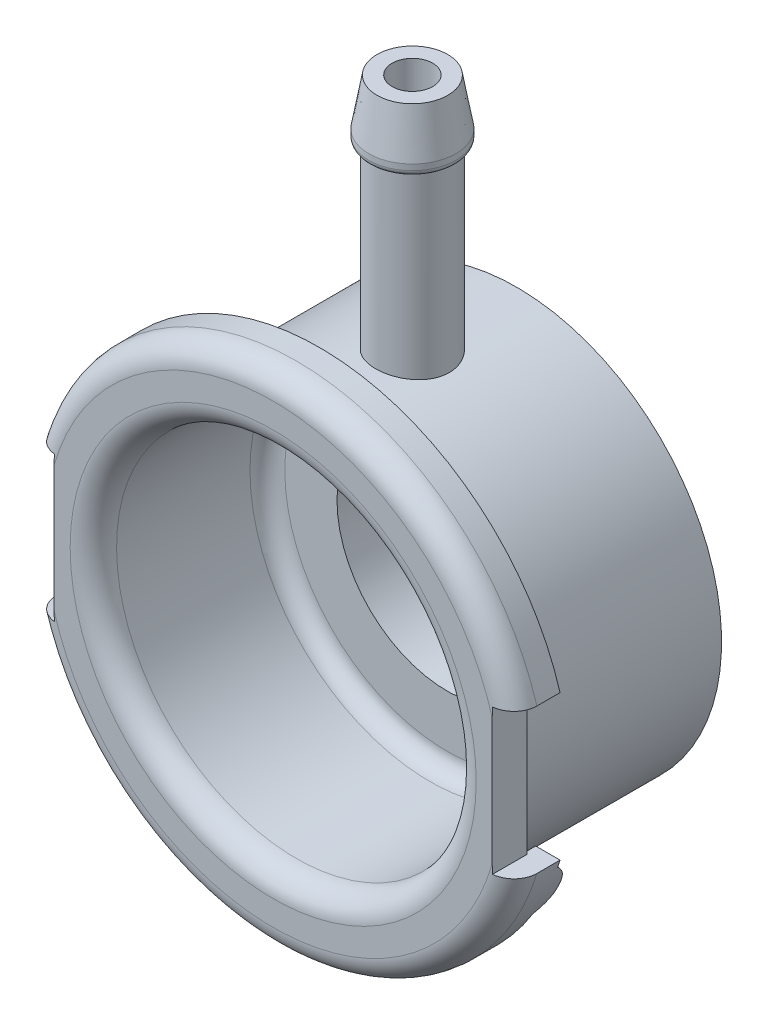
from build123d import *

# Parameters (mm, degrees)
SKETCH1_R                = 17.65
SKETCH1_R_2              = 15.5
BOSS_EXTRUDE1_DEPTH      = 18
BOSS_EXTRUDE2_START      = -3
SKETCH2_R                = 21.65
SKETCH2_R_2              = 15.5
BOSS_EXTRUDE2_DEPTH      = 3
SKETCH3_W                = 5
SKETCH3_H                = 12.5
CUT_EXTRUDE1_DEPTH       = 36.516826998
BOSS_EXTRUDE3_START      = 1
BOSS_EXTRUDE3_DEPTH      = 1
BOSS_EXTRUDE4_START      = 1
BOSS_EXTRUDE4_DEPTH      = 1
CIRPATTERN1_COUNT        = 2
FILLET1_R                = 3
FILLET2_R                = 2
SKETCH6_R                = 1.75
CUT_EXTRUDE2_DEPTH       = 35.96258732
BOSS_EXTRUDE5_REACH      = 74.963
BOSS_EXTRUDE5_END_RADIUS = 17.65
BOSS_EXTRUDE5_START      = 38
SKETCH6_4_R              = 3.175
SKETCH6_4_R_2            = 1.75
SKETCH7_R                = 3.755
SKETCH7_R_2              = 1.75
BOSS_EXTRUDE6_DEPTH      = 5
CHAMFER1_SIZE            = 4
CHAMFER1_SIZE2           = 0.705307923
BOSS_EXTRUDE7_DEPTH      = 3
BOSS_EXTRUDE7_DEPTH_BACK = 3
SKETCH8_R                = 17.65
SKETCH8_R_2              = 9.5
FILLET4_R                = 1.5
FILLET5_R                = 0.5


with BuildPart() as part:
    # Sketch1 → Boss-Extrude1 (new body)
    with BuildSketch(Plane.XY):
        Circle(SKETCH1_R)
        Circle(SKETCH1_R_2, mode=Mode.SUBTRACT)
    extrude(amount=BOSS_EXTRUDE1_DEPTH)

    # Sketch2 → Boss-Extrude2 (add)
    with BuildSketch(Plane.XY.offset(18).offset(BOSS_EXTRUDE2_START)):
        Circle(SKETCH2_R)
        Circle(SKETCH2_R_2, mode=Mode.SUBTRACT)
    extrude(amount=BOSS_EXTRUDE2_DEPTH)

    # Sketch3 → Cut-Extrude1 (cut, through all)
    with BuildSketch(Plane.XY.offset(18)):
        with Locations((21.38, 0)):
            Rectangle(SKETCH3_W, SKETCH3_H)
        with Locations((-21.38, 0)):
            Rectangle(SKETCH3_W, SKETCH3_H)
    extrude(amount=-CUT_EXTRUDE1_DEPTH, mode=Mode.SUBTRACT)

    # Sketch4 → Boss-Extrude3 (add)
    with BuildSketch(Plane(origin=(0, 0, 15), x_dir=(-1, 0, 0), z_dir=(0, 0, -1)).offset(BOSS_EXTRUDE3_START)):
        with BuildLine():
            Line((-20.728241604, -6.25), (-18.629546425, -6.25))
            ThreePointArc((-18.629546425, -6.25), (0, -19.65), (18.629546425, -6.25))
            Line((18.629546425, -6.25), (20.728241604, -6.25))
            ThreePointArc((20.728241604, -6.25), (0, -21.65), (-20.728241604, -6.25))
        make_face()
        with BuildLine():
            Line((-20.728241604, 6.25), (-18.629546425, 6.25))
            ThreePointArc((-18.629546425, 6.25), (0, 19.65), (18.629546425, 6.25))
            Line((18.629546425, 6.25), (20.728241604, 6.25))
            ThreePointArc((20.728241604, 6.25), (0, 21.65), (-20.728241604, 6.25))
        make_face()
    extrude(amount=-BOSS_EXTRUDE3_DEPTH)

    # Sketch5 → Boss-Extrude4 (add)
    with BuildSketch(Plane(origin=(0, 0, 14), x_dir=(-1, 0, 0), z_dir=(0, 0, -1)).offset(BOSS_EXTRUDE4_START)):
        with BuildLine():
            Line((-18.629546425, -6.25), (-20.525683466, -6.886132316))
            ThreePointArc((-20.525683466, -6.886132316), (-19.593212906, -9.210239302), (-18.398607414, -11.411123749))
            Line((-18.398607414, -11.411123749), (-16.698967007, -10.356978368))
            ThreePointArc((-16.698967007, -10.356978368), (-17.783216333, -8.359408882), (-18.629546425, -6.25))
        make_face()
    boss_extrude4 = extrude(amount=-BOSS_EXTRUDE4_DEPTH)

    # CirPattern1: Boss-Extrude4 ×2 about axis
    cirpattern1_axis = Axis((0, 0, 0), (0, 0, 1))
    for i in range(1, CIRPATTERN1_COUNT):
        add(boss_extrude4.rotate(cirpattern1_axis, i * 360 / CIRPATTERN1_COUNT))

    # Fillet1
    # the kernel refuses this fillet: 3 mm, written as the material it takes off along each edge
    with BuildSketch(Plane(origin=(-23.149246776, 14.357549661, 13), x_dir=(0, 0, 1), z_dir=(0.8498202038966606, -0.527072690479253, 0))) as fillet1_piece_1_section:
        with BuildLine():
            CenterArc((3, 2.236067977), FILLET1_R, 180, 48.189685104)
            Line((0, 2.236067977), (0, 0))
            Line((0, 0), (1, 0))
        make_face()
    fillet1_piece_1 = extrude(amount=13.180339887, mode=Mode.PRIVATE)
    fillet1_piece_1 = fillet1_piece_1 - Plane(origin=(0, 0, 13.255909987), x_dir=(0.9480685203545537, 0.3180661577608143, 0), z_dir=(0, 0, -1)) * Cylinder(19.65, 36, mode=Mode.PRIVATE)
    add(fillet1_piece_1, mode=Mode.SUBTRACT)
    with BuildSketch(Plane(origin=(-13.329682278, 4.471956125, 13), x_dir=(0, 0, 1), z_dir=(-0.9480685203545541, 0.3180661577608135, 0))) as fillet1_piece_2_section:
        with BuildLine():
            CenterArc((3, 2.236067977), FILLET1_R, 180, 48.189685104)
            Line((0, 2.236067977), (0, 0))
            Line((0, 0), (1, 0))
        make_face()
    fillet1_piece_2 = extrude(amount=13.180339887, mode=Mode.PRIVATE)
    fillet1_piece_2 = fillet1_piece_2 - Plane(origin=(0, 0, 13.255909987), x_dir=(0.9480685203545537, 0.3180661577608143, 0), z_dir=(0, 0, -1)) * Cylinder(19.65, 36, mode=Mode.PRIVATE)
    add(fillet1_piece_2, mode=Mode.SUBTRACT)
    with BuildSketch(Plane(origin=(23.149246776, -14.357549661, 13), x_dir=(0, 0, 1), z_dir=(-0.8498202038966607, 0.5270726904792529, 0))) as fillet1_piece_3_section:
        with BuildLine():
            CenterArc((3, 2.236067977), FILLET1_R, 180, 48.189685104)
            Line((0, 2.236067977), (0, 0))
            Line((0, 0), (1, 0))
        make_face()
    fillet1_piece_3 = extrude(amount=13.180339887, mode=Mode.PRIVATE)
    fillet1_piece_3 = fillet1_piece_3 - Plane(origin=(0, 0, 13.255909987), x_dir=(0.9480685203545538, -0.3180661577608143, 0), z_dir=(0, 0, -1)) * Cylinder(19.65, 36, mode=Mode.PRIVATE)
    add(fillet1_piece_3, mode=Mode.SUBTRACT)
    with BuildSketch(Plane(origin=(13.329682278, -4.471956125, 13), x_dir=(-0.3180661577608133, -0.9480685203545539, 0), z_dir=(0.9480685203545541, -0.3180661577608134, 0))) as fillet1_piece_4_section:
        with BuildLine():
            CenterArc((2.236067977, -3), FILLET1_R, 90, 48.189685104)
            Line((0, -1), (0, 0))
            Line((0, 0), (2.236067977, 0))
        make_face()
    fillet1_piece_4 = extrude(amount=13.180339887, mode=Mode.PRIVATE)
    fillet1_piece_4 = fillet1_piece_4 - Plane(origin=(0, 0, 13.255909987), x_dir=(0.9480685203545538, -0.3180661577608143, 0), z_dir=(0, 0, -1)) * Cylinder(19.65, 36, mode=Mode.PRIVATE)
    add(fillet1_piece_4, mode=Mode.SUBTRACT)

    # Fillet2
    fillet2_edges = [part.edges().sort_by_distance(p)[0] for p in [
        (0, 21.65, 18),
        (-15.5, 0, 18),
        (0, -21.65, 18),
    ]]
    fillet(fillet2_edges, radius=FILLET2_R)

    # Sketch6 → Cut-Extrude2 (cut, through all)
    with BuildSketch(Plane(origin=(0, 0, 0), x_dir=(1, 0, 0), z_dir=(0, 1, 0))):
        with Locations(Location((0, -6, 0), (0, 0, 90))):
            Circle(SKETCH6_R)
    extrude(amount=CUT_EXTRUDE2_DEPTH, mode=Mode.SUBTRACT)

    # Boss-Extrude5: up to this cylinder (the profile starts outside it)
    boss_extrude5_end = Plane(origin=(0, 0, 2.914803), z_dir=(0, 0, -1)) * Cylinder(BOSS_EXTRUDE5_END_RADIUS, 186.226, mode=Mode.PRIVATE)
    # Sketch6<4> → Boss-Extrude5 (add, up to the surface)
    with BuildSketch(Plane(origin=(0, 0, 0), x_dir=(1, 0, 0), z_dir=(0, 1, 0)).offset(BOSS_EXTRUDE5_START), mode=Mode.PRIVATE) as boss_extrude5_sk1:
        with Locations(Location((0, -6, 0), (0, 0, 270))):
            Circle(SKETCH6_4_R)
        with Locations(Location((0, -6, 0), (0, 0, 90))):
            Circle(SKETCH6_4_R_2, mode=Mode.SUBTRACT)
    boss_extrude5_tool1 = extrude(boss_extrude5_sk1.sketch, amount=-BOSS_EXTRUDE5_REACH, mode=Mode.PRIVATE) - boss_extrude5_end
    add(boss_extrude5_tool1.solids().sort_by_distance((0, 38, 2.914803))[0])

    # Sketch7 → Boss-Extrude6 (add)
    with BuildSketch(Plane(origin=(0, 38, 0), x_dir=(1, 0, 0), z_dir=(0, 1, 0))):
        with Locations(Location((0, -6, 0), (0, 0, 270))):
            Circle(SKETCH7_R)
        with Locations(Location((0, -6, 0), (0, 0, 90))):
            Circle(SKETCH7_R_2, mode=Mode.SUBTRACT)
    extrude(amount=-BOSS_EXTRUDE6_DEPTH)

    # Chamfer1
    chamfer1_edges = [part.edges().sort_by_distance(p)[0] for p in [
        (0, 38, 2.245),
    ]]
    chamfer1_side = [part.faces().sort_by_distance(p)[0] for p in [
        (0, 35.5, 2.245),
    ]]
    chamfer(chamfer1_edges, length=CHAMFER1_SIZE, length2=CHAMFER1_SIZE2, reference=chamfer1_side[0])

    # Sketch8 → Boss-Extrude7 (add, two sides: drawn at the far end of the back side and taken through both)
    with BuildSketch(Plane(origin=(0, 0, 0), x_dir=(-1, 0, 0), z_dir=(0, 0, -1)).offset(-BOSS_EXTRUDE7_DEPTH_BACK)):
        Circle(SKETCH8_R)
        Circle(SKETCH8_R_2, mode=Mode.SUBTRACT)
    extrude(amount=BOSS_EXTRUDE7_DEPTH + BOSS_EXTRUDE7_DEPTH_BACK)

    # Fillet4
    fillet4_edges = [part.edges().sort_by_distance(p)[0] for p in [
        (-15.5, 0, 3),
    ]]
    fillet(fillet4_edges, radius=FILLET4_R)

    # Fillet5
    fillet5_edges = [part.edges().sort_by_distance(p)[0] for p in [
        (0, 33, 2.245),
    ]]
    fillet(fillet5_edges, radius=FILLET5_R)


solid = part.part
